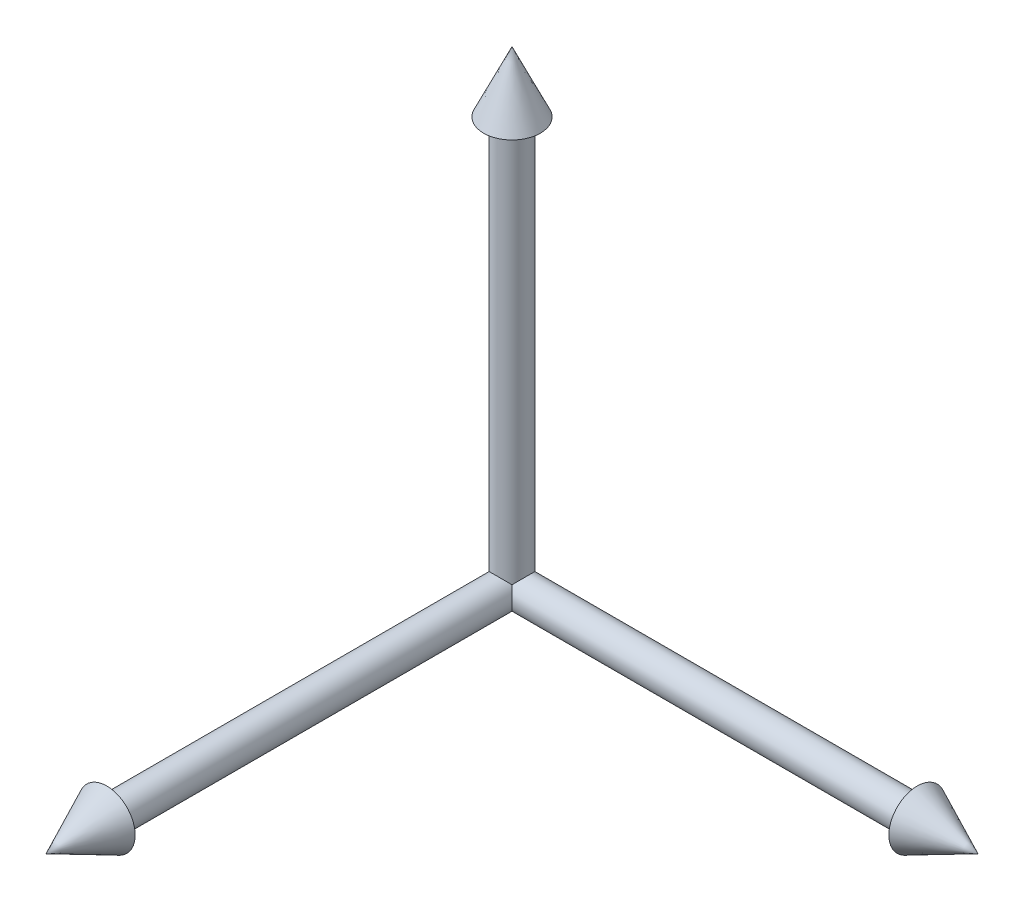
from build123d import *

# Parameters (mm, degrees)
SKETCH4_R         = 0.4
SKETCH5_R         = 0.7
CIRPATTERN2_COUNT = 2
CIRPATTERN2_ANGLE = 90


# Read off the part's stored shape, not the designer's step: CirPattern1
with BuildPart() as part:
    # Sweep1: sweep along a path in Sketch2
    with BuildLine(Plane(origin=(0, 0, 0), x_dir=(1, 0, 0), z_dir=(0, 1, 0))) as sweep1_path:
        Line((0, 0), (0, -10))
    # Sketch4 → Sweep1 (sweep)
    with BuildSketch(Plane.XY):
        Circle(SKETCH4_R)
    sweep1 = sweep(path=sweep1_path.line)

    # Sketch5 → Loft1 section 0
    with BuildSketch(Plane.XY.offset(10), mode=Mode.PRIVATE) as loft1_s0:
        Circle(SKETCH5_R)
    loft1 = loft([loft1_s0.sketch, Vertex(0, 0, 11.5)])

    # CirPattern1 outline → CirPattern1 (revolve)
    with BuildSketch(Plane.YX):
        Polygon((0.7, 10), (0, 11.5), (0, 0), (0.4, 0), (0.4, 10), align=None)
    revolve(axis=Axis((0, 0, 0), (1, 0, 0)))

    # CirPattern2: Sweep1, Loft1 ×2 about axis
    cirpattern2_axis = Axis((0, 0, 0), (-1, 0, 0))
    add([sweep1.rotate(cirpattern2_axis, i * CIRPATTERN2_ANGLE / (CIRPATTERN2_COUNT - 1)) for i in range(1, CIRPATTERN2_COUNT)])
    add([loft1.rotate(cirpattern2_axis, i * CIRPATTERN2_ANGLE / (CIRPATTERN2_COUNT - 1)) for i in range(1, CIRPATTERN2_COUNT)])


solid = part.part
